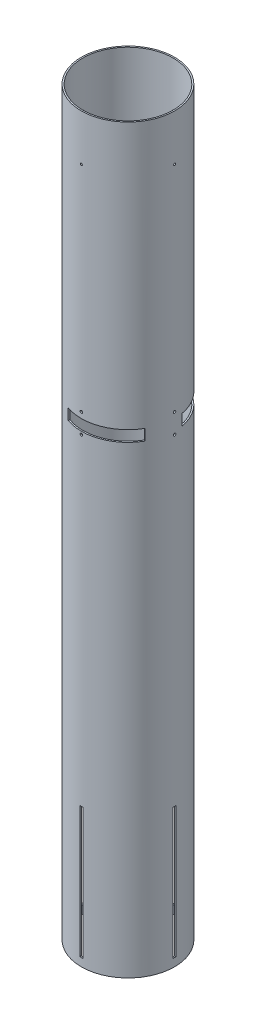
from build123d import *

# Parameters (mm, degrees)
SKETCH1_R              = 51.1048
SKETCH1_R_2            = 49.53
BOSS_EXTRUDE1_DEPTH    = 812.8
CUT_EXTRUDE1_DEPTH     = 817.00688794
CIRPATTERN1_COUNT      = 4
CUT_EXTRUDE2_DEPTH     = 817.00688794
CIRPATTERN2_COUNT      = 4
SKETCH3_R              = 3.175
CUT_EXTRUDE3_DEPTH     = 817.006888053
CUT_EXTRUDE4_START     = 508.635
CUT_EXTRUDE4_DEPTH     = 12.065
CIRPATTERN3_COUNT      = 3
LPATTERN1_COPY_1_DEPTH = 817.00688794
LPATTERN1_COPY_2_DEPTH = 817.00688794
LPATTERN1_COPY_3_DEPTH = 817.00688794
LPATTERN1_COPY_4_DEPTH = 817.00688794
SKETCH8_R              = 1.0922
CUT_EXTRUDE5_DEPTH     = 817.006888053
CIRPATTERN4_COUNT      = 4


with BuildPart() as part:
    # Sketch1 → Boss-Extrude1 (new body)
    with BuildSketch(Plane(origin=(0, 0, 0), x_dir=(1, 0, 0), z_dir=(0, 1, 0))):
        Circle(SKETCH1_R)
        Circle(SKETCH1_R_2, mode=Mode.SUBTRACT)
    extrude(amount=BOSS_EXTRUDE1_DEPTH)

    # Sketch2 → Cut-Extrude1 (cut, through all)
    with BuildSketch(Plane(origin=(0, 0, 0), x_dir=(0, 0, -1), z_dir=(1, 0, 0))):
        Polygon((0, 8.89), (1.5875, 8.89), (1.5875, 152.4), (-1.5875, 152.4), (-1.5875, 8.89), align=None)
    cut_extrude1 = extrude(amount=-CUT_EXTRUDE1_DEPTH, mode=Mode.SUBTRACT)

    # CirPattern1: Cut-Extrude1 ×4 about axis
    cirpattern1_axis = Axis((0, 0, 0), (0, 1, 0))
    for i in range(1, CIRPATTERN1_COUNT):
        add(cut_extrude1.rotate(cirpattern1_axis, i * 360 / CIRPATTERN1_COUNT), mode=Mode.SUBTRACT)

    # Sketch2<3> → Cut-Extrude2 (cut, through all)
    with BuildSketch(Plane(origin=(0, 0, 0), x_dir=(0, 0, -1), z_dir=(1, 0, 0))):
        with BuildLine():
            ThreePointArc((0, 528.40255), (-0.956397277, 526.093602723), (1.35255, 527.05))
            ThreePointArc((1.35255, 527.05), (0.956397277, 528.006397277), (0, 528.40255))
        make_face()
    cut_extrude2 = extrude(amount=-CUT_EXTRUDE2_DEPTH, mode=Mode.SUBTRACT)

    # CirPattern2: Cut-Extrude2 ×4 about axis
    cirpattern2_axis = Axis((0, 812.8, 0), (0, -1, 0))
    for i in range(1, CIRPATTERN2_COUNT):
        add(cut_extrude2.rotate(cirpattern2_axis, i * 360 / CIRPATTERN2_COUNT), mode=Mode.SUBTRACT)

    # Sketch3 → Cut-Extrude3 (cut, through all)
    with BuildSketch(Plane(origin=(0, 0, 0), x_dir=(0.7071067811865477, 0, -0.7071067811865475), z_dir=(0.7071067811865475, 0, 0.7071067811865477))):
        with Locations((0, 127)):
            Circle(SKETCH3_R)
    extrude(amount=-CUT_EXTRUDE3_DEPTH, mode=Mode.SUBTRACT)

    # Sketch7 → Cut-Extrude4 (cut)
    with BuildSketch(Plane(origin=(0, 0, 0), x_dir=(1, 0, 0), z_dir=(0, 1, 0)).offset(CUT_EXTRUDE4_START)):
        with BuildLine():
            Line((-44.258055055, -25.5524), (-42.894238249, -24.765))
            ThreePointArc((-42.894238249, -24.765), (-48.777528007, 8.60079424), (-31.837270308, 37.942181268))
            Line((-31.837270308, 37.942181268), (-32.849532236, 39.148548057))
            ThreePointArc((-32.849532236, 39.148548057), (-46.026790738, 22.208897258), (-51.086898433, 1.35255))
            ThreePointArc((-51.086898433, 1.35255), (-51.1048, 0), (-51.086898433, -1.35255))
            ThreePointArc((-51.086898433, -1.35255), (-49.184074902, -13.87902587), (-44.258055055, -25.5524))
        make_face()
    cut_extrude4 = extrude(amount=CUT_EXTRUDE4_DEPTH, mode=Mode.SUBTRACT)

    # CirPattern3: Cut-Extrude4 ×3 about axis
    cirpattern3_axis = Axis((0, 812.8, 0), (0, -1, 0))
    for i in range(1, CIRPATTERN3_COUNT):
        add(cut_extrude4.rotate(cirpattern3_axis, i * 360 / CIRPATTERN3_COUNT), mode=Mode.SUBTRACT)

    # LPattern1 copy 1 sketch → LPattern1 copy 1 (cut, through all)
    with BuildSketch(Plane(origin=(0, -21.6916, 0), x_dir=(1, 0, 0), z_dir=(0, 0, 1))):
        with BuildLine():
            ThreePointArc((0, 528.40255), (-0.956397277, 526.093602723), (1.35255, 527.05))
            ThreePointArc((1.35255, 527.05), (0.956397277, 528.006397277), (0, 528.40255))
        make_face()
    extrude(amount=-LPATTERN1_COPY_1_DEPTH, mode=Mode.SUBTRACT)

    # LPattern1 copy 2 sketch → LPattern1 copy 2 (cut, through all)
    with BuildSketch(Plane(origin=(0, -21.6916, 0), x_dir=(0, 0, 1), z_dir=(-1, 0, 0))):
        with BuildLine():
            ThreePointArc((0, 528.40255), (-0.956397277, 526.093602723), (1.35255, 527.05))
            ThreePointArc((1.35255, 527.05), (0.956397277, 528.006397277), (0, 528.40255))
        make_face()
    extrude(amount=-LPATTERN1_COPY_2_DEPTH, mode=Mode.SUBTRACT)

    # LPattern1 copy 3 sketch → LPattern1 copy 3 (cut, through all)
    with BuildSketch(Plane(origin=(0, -21.6916, 0), x_dir=(-1, 0, 0), z_dir=(0, 0, -1))):
        with BuildLine():
            ThreePointArc((0, 528.40255), (-0.956397277, 526.093602723), (1.35255, 527.05))
            ThreePointArc((1.35255, 527.05), (0.956397277, 528.006397277), (0, 528.40255))
        make_face()
    extrude(amount=-LPATTERN1_COPY_3_DEPTH, mode=Mode.SUBTRACT)

    # LPattern1 copy 4 sketch → LPattern1 copy 4 (cut, through all)
    with BuildSketch(Plane(origin=(0, -21.6916, 0), x_dir=(0, 0, -1), z_dir=(1, 0, 0))):
        with BuildLine():
            ThreePointArc((0, 528.40255), (-0.956397277, 526.093602723), (1.35255, 527.05))
            ThreePointArc((1.35255, 527.05), (0.956397277, 528.006397277), (0, 528.40255))
        make_face()
    extrude(amount=-LPATTERN1_COPY_4_DEPTH, mode=Mode.SUBTRACT)

    # Sketch8 → Cut-Extrude5 (cut, through all)
    with BuildSketch(Plane.XY):
        with Locations((0, 762)):
            Circle(SKETCH8_R)
    cut_extrude5 = extrude(amount=-CUT_EXTRUDE5_DEPTH, mode=Mode.SUBTRACT)

    # CirPattern4: Cut-Extrude5 ×4 about axis
    cirpattern4_axis = Axis((0, 812.8, 0), (0, -1, 0))
    for i in range(1, CIRPATTERN4_COUNT):
        add(cut_extrude5.rotate(cirpattern4_axis, i * 360 / CIRPATTERN4_COUNT), mode=Mode.SUBTRACT)


solid = part.part
